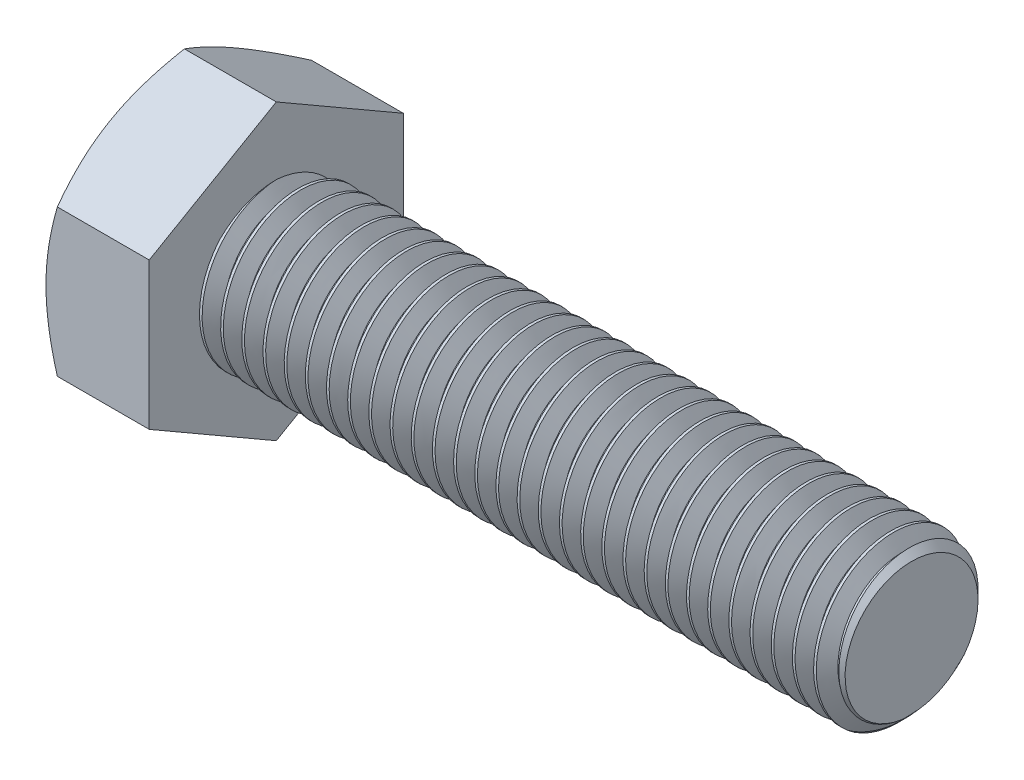
from build123d import *

# Parameters (mm, degrees)
SKETCH5_R           = 3.96875
BOSS_EXTRUDE3_DEPTH = 31.75
CHAMFER1_SIZE       = 0.6477
CUT_SWEEP1_PITCH    = 1.058333333
BOSS_EXTRUDE4_DEPTH = 5.159375
SKETCH8_OUTSIDE_W   = 158.702
SKETCH8_OUTSIDE_H   = 160.666
SKETCH8_OUTSIDE_R   = 6.35
CUT_EXTRUDE3_DEPTH  = 39.162649363
CUT_EXTRUDE3_DRAFT  = -60
CUT_EXTRUDE4_DEPTH  = 0.254
CIRPATTERN1_COUNT   = 3


with BuildPart() as part:
    # Sketch5 → Boss-Extrude3 (new body)
    with BuildSketch(Plane(origin=(18.4546875, 0, 0), x_dir=(0, 0, -1), z_dir=(1, 0, 0))):
        Circle(SKETCH5_R)
    extrude(amount=-BOSS_EXTRUDE3_DEPTH)

    # Chamfer1
    chamfer1_edges = [part.edges().sort_by_distance(p)[0] for p in [
        (18.4546875, 0, 3.96875),
    ]]
    chamfer(chamfer1_edges, length=CHAMFER1_SIZE)

    # Cut-Sweep1: arcs per turn and ends read off the stored shape
    # Cut-Sweep1: the profile of Sketch10 profile screwed along a right-hand helix through 31 turns, 8 arcs to a turn; built about Z, then put on its axis
    cut_sweep1_z = Axis((0, 0, 0), (0, 0, 1))
    cut_sweep1_corners = [(3.96905, 0, 0.000173205), (3.281342336, 0, -0.396875), (3.281342336, 0, -0.529166667), (3.96905, 0, -0.926214872)]
    with BuildLine(mode=Mode.PRIVATE) as cut_sweep1_profile:
        Line(cut_sweep1_corners[0], cut_sweep1_corners[1])
        Line(cut_sweep1_corners[1], cut_sweep1_corners[2])
        Line(cut_sweep1_corners[2], cut_sweep1_corners[3])
        Line(cut_sweep1_corners[3], cut_sweep1_corners[0])
    cut_sweep1_cap = Face(cut_sweep1_profile.wire())
    cut_sweep1_turn_angles = [0, 22.5, 45, 67.5, 90, 112.5, 135, 157.5, 180, 202.5, 225, 247.5, 270, 292.5, 315, 337.5, 360]
    cut_sweep1_turn_weights = [1, 0.9238795325112867, 1, 0.9238795325112867, 1, 0.9238795325112867, 1, 0.9238795325112867, 1, 0.9238795325112867, 1, 0.9238795325112867, 1, 0.9238795325112867, 1, 0.9238795325112867, 1]
    cut_sweep1_turn_rails = [Edge.make_bspline([Vector(p[0], p[1], 0).rotate(cut_sweep1_z, cut_sweep1_turn_angles[k]) / cut_sweep1_turn_weights[k] + Vector(0, 0, p[2] + CUT_SWEEP1_PITCH * cut_sweep1_turn_angles[k] / 360) for k in range(17)], [0, 0, 0, 1, 1, 2, 2, 3, 3, 4, 4, 5, 5, 6, 6, 7, 7, 8, 8, 8], 2, cut_sweep1_turn_weights) for p in cut_sweep1_corners]
    cut_sweep1_turn_sides = [Face.make_surface_from_curves(cut_sweep1_turn_rails[p[0]], cut_sweep1_turn_rails[p[1]]) for p in [(0, 1), (1, 2), (2, 3), (3, 0)]]
    cut_sweep1 = Plane(origin=(18.4546875, 0, 0), x_dir=(0, 1, 0), z_dir=(-1, 0, 0)) * Solid(Shell([*[p.moved(Location((0, 0, CUT_SWEEP1_PITCH * i))) for i in range(31) for p in cut_sweep1_turn_sides], cut_sweep1_cap, cut_sweep1_cap.rotate(cut_sweep1_z, 11160).moved(Location((0, 0, CUT_SWEEP1_PITCH * 11160 / 360)))]))
    add(cut_sweep1, mode=Mode.SUBTRACT)

    # Sketch6 → Boss-Extrude4 (add)
    with BuildSketch(Plane.ZY.offset(13.2953125)):
        Polygon((6.35, 3.666174209), (0, 7.332348419), (-6.35, 3.666174209), (-6.35, -3.666174209), (0, -7.332348419), (6.35, -3.666174209), align=None)
    extrude(amount=BOSS_EXTRUDE4_DEPTH)


with BuildPart() as cut_extrude3_tool:
    # Sketch8 outside → Cut-Extrude3 (with draft: the straight prism first)
    with BuildSketch(Plane.ZY.offset(18.4546875)):
        Rectangle(SKETCH8_OUTSIDE_W, SKETCH8_OUTSIDE_H)
        Circle(SKETCH8_OUTSIDE_R, mode=Mode.SUBTRACT)
    extrude(amount=-CUT_EXTRUDE3_DEPTH)
    # Cut-Extrude3: the draft: its side faces are tilted about the plane it starts from
    cut_extrude3_sides = [cut_extrude3_tool.faces().sort_by_distance(p)[0] for p in [
        (1.126637181, -80.333, 0),
        (1.126637181, 0, 79.351),
        (1.126637181, 80.333, 0),
        (1.126637181, 0, -79.351),
        (1.126637181, 0, -6.35),
    ]]
    draft(cut_extrude3_sides, Plane.ZY.offset(18.4546875), CUT_EXTRUDE3_DRAFT)


with BuildPart() as part_1:
    add(part.part)

    # Cut-Extrude3: cut by cut_extrude3_tool
    add(cut_extrude3_tool.part, mode=Mode.SUBTRACT)

    # Sketch12 → Cut-Extrude4 (cut)
    with BuildSketch(Plane.ZY.offset(18.4546875)):
        with BuildLine():
            Line((0.1905, 4.8895), (0.1905, 2.7305))
            ThreePointArc((0.1905, 2.7305), (0, 2.54), (-0.1905, 2.7305))
            Line((-0.1905, 2.7305), (-0.1905, 4.8895))
            ThreePointArc((-0.1905, 4.8895), (0, 5.08), (0.1905, 4.8895))
        make_face()
    cut_extrude4 = extrude(amount=-CUT_EXTRUDE4_DEPTH, mode=Mode.SUBTRACT)

    # CirPattern1: Cut-Extrude4 ×3 about axis
    cirpattern1_axis = Axis((0, 0, 0), (1, 0, 0))
    for i in range(1, CIRPATTERN1_COUNT):
        add(cut_extrude4.rotate(cirpattern1_axis, i * 360 / CIRPATTERN1_COUNT), mode=Mode.SUBTRACT)


solid = part_1.part
